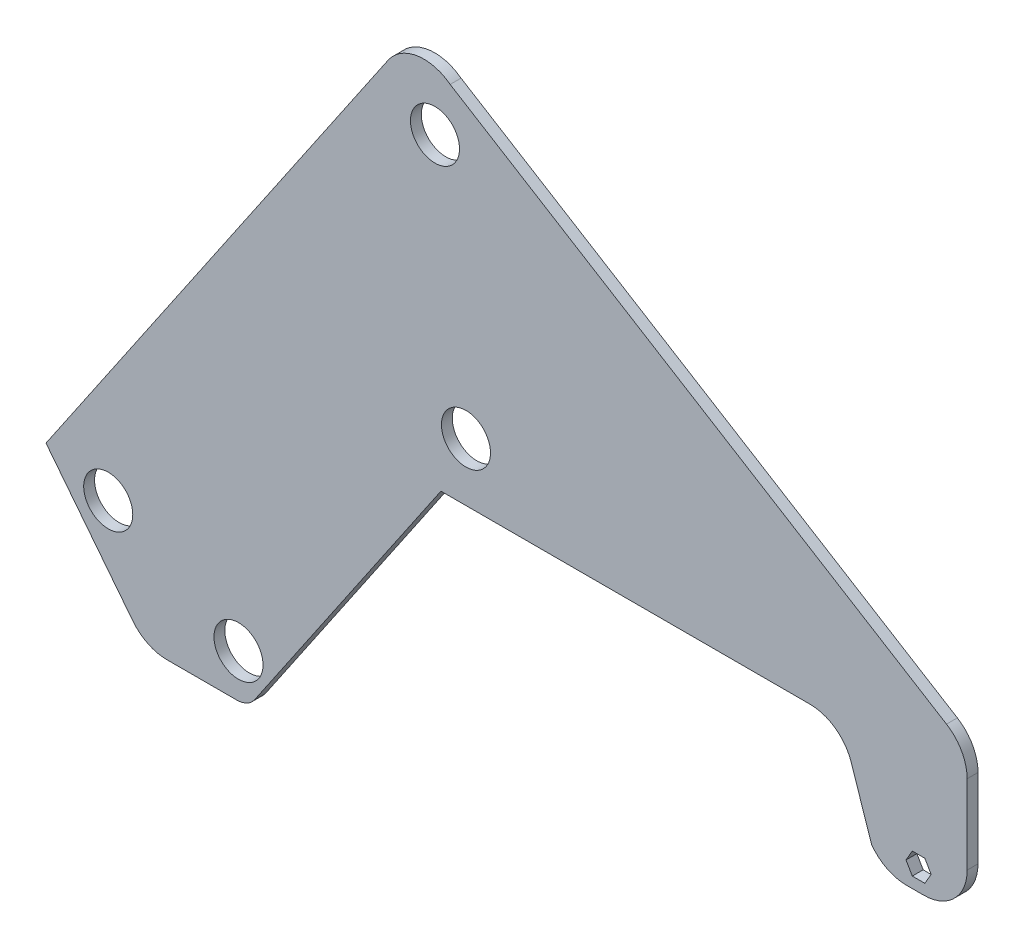
from build123d import *

# Parameters (mm, degrees)
MODEL_R             = 14.351
BOSS_EXTRUDE1_DEPTH = 6.35


with BuildPart() as part:
    # Model → Boss-Extrude1 (new body)
    with BuildSketch(Plane.XY):
        with BuildLine():
            Line((-314.23831963, -55.359484793), (-205.338802982, 104.650248016))
            Line((-205.338802982, 104.650248016), (-11.396613492, 104.650248016))
            Line((-11.396613492, 104.650248016), (-2.138802982, 104.650248016))
            Line((-2.138802982, 104.650248016), (10.561197018, 104.650248016))
            ThreePointArc((10.561197018, 104.650248016), (25.411048982, 99.857089032), (34.656357532, 87.286617831))
            Line((34.656357532, 87.286617831), (46.592108535, 51.500082009))
            ThreePointArc((46.592108535, 51.500082009), (55.588253468, 43.884919686), (67.053108098, 41.150248016))
            Line((67.053108098, 41.150248016), (77.072108535, 41.150248016))
            ThreePointArc((77.072108535, 41.150248016), (95.032620777, 48.589735774), (102.472108535, 66.550248016))
            Line((102.472108535, 66.550248016), (102.472108535, 83.872407327))
            Line((102.472108535, 83.872407327), (102.472108535, 112.853785651))
            ThreePointArc((102.472108535, 112.853785651), (99.24880288, 125.237413065), (90.396972478, 134.478031323))
            Line((90.396972478, 134.478031323), (-199.949582693, 313.389629113))
            ThreePointArc((-199.949582693, 313.389629113), (-219.402189514, 318.224062751), (-236.303247901, 307.447705012))
            Line((-236.303247901, 307.447705012), (-436.377385414, 13.472026599))
            Line((-436.377385414, 13.472026599), (-385.58146606, -51.20282143))
            ThreePointArc((-385.58146606, -51.20282143), (-376.71145599, -58.357541068), (-365.605974805, -60.913979882))
            Line((-365.605974805, -60.913979882), (-324.737451002, -60.913979882))
            ThreePointArc((-324.737451002, -60.913979882), (-318.798508014, -59.439796386), (-314.23831963, -55.359484793))
        make_face()
        with Locations((-323.775189267, -35.513979882)):
            Circle(MODEL_R, mode=Mode.SUBTRACT)
        with Locations((-399.975189267, 2.586020118)):
            Circle(MODEL_R, mode=Mode.SUBTRACT)
        Polygon((77.727371227, 60.200248016), (81.393545437, 53.850248016), (77.727371227, 47.500248016), (70.395022809, 47.500248016), (66.728848599, 53.850248016), (70.395022809, 60.200248016), align=None, mode=Mode.SUBTRACT)
        with Locations((-190.707148919, 138.516914683)):
            Circle(MODEL_R, mode=Mode.SUBTRACT)
        with Locations((-208.832932893, 283.437784316)):
            Circle(MODEL_R, mode=Mode.SUBTRACT)
    extrude(amount=BOSS_EXTRUDE1_DEPTH)


solid = part.part
